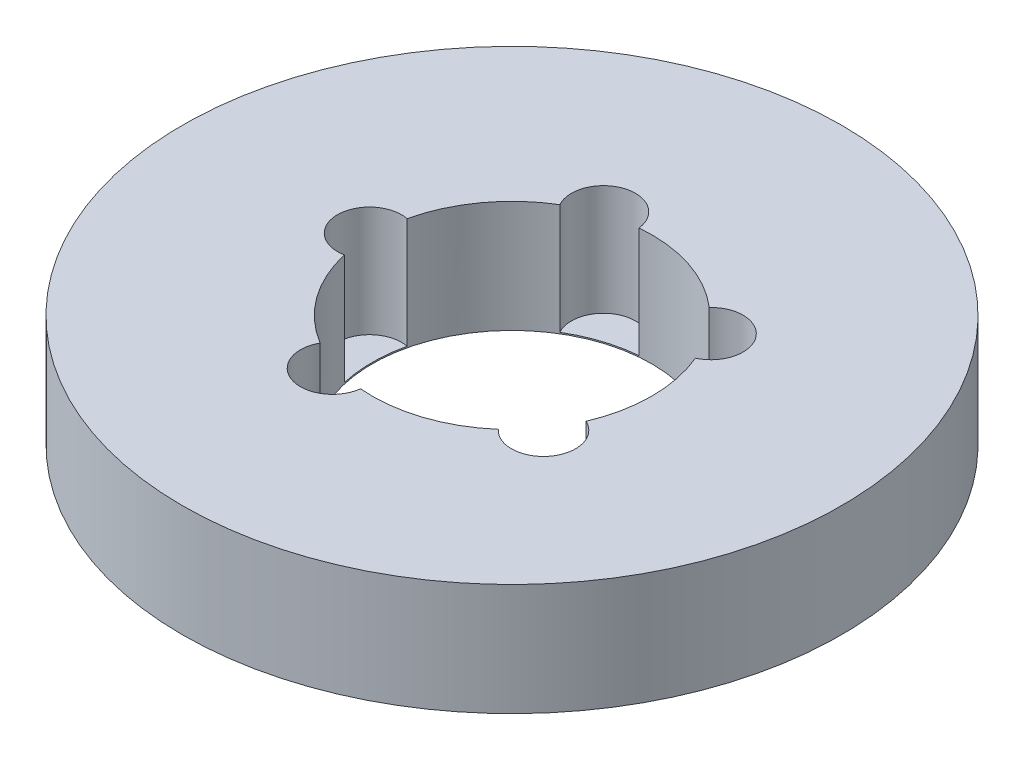
from build123d import *

# Parameters (mm, degrees)
SKETCH1_R           = 82.5
BOSS_EXTRUDE1_DEPTH = 28
SKETCH2_R           = 35
CUT_EXTRUDE1_DEPTH  = 120.98541578
SKETCH3_R           = 8.020540442
CUT_EXTRUDE2_DEPTH  = 27.674716257
CIRPATTERN1_COUNT   = 5


with BuildPart() as part:
    # Sketch1 → Boss-Extrude1 (new body)
    with BuildSketch(Plane(origin=(0, 0, 0), x_dir=(1, 0, 0), z_dir=(0, 1, 0))):
        Circle(SKETCH1_R)
    extrude(amount=BOSS_EXTRUDE1_DEPTH)

    # Sketch2 → Cut-Extrude1 (cut, through all)
    with BuildSketch(Plane(origin=(0, 0, 0), x_dir=(1, 0, 0), z_dir=(0, 1, 0))):
        Circle(SKETCH2_R)
    extrude(amount=CUT_EXTRUDE1_DEPTH, mode=Mode.SUBTRACT)

    # Sketch3 → Cut-Extrude2 (cut)
    with BuildSketch(Plane(origin=(0, 28, 0), x_dir=(1, 0, 0), z_dir=(0, 1, 0))):
        with Locations((-35.665635629, 0)):
            Circle(SKETCH3_R)
    cut_extrude2 = extrude(amount=-CUT_EXTRUDE2_DEPTH, mode=Mode.SUBTRACT)

    # CirPattern1: Cut-Extrude2 ×5 about axis
    cirpattern1_axis = Axis((0, 0, 0), (0, 1, 0))
    for i in range(1, CIRPATTERN1_COUNT):
        add(cut_extrude2.rotate(cirpattern1_axis, i * 360 / CIRPATTERN1_COUNT), mode=Mode.SUBTRACT)


solid = part.part
